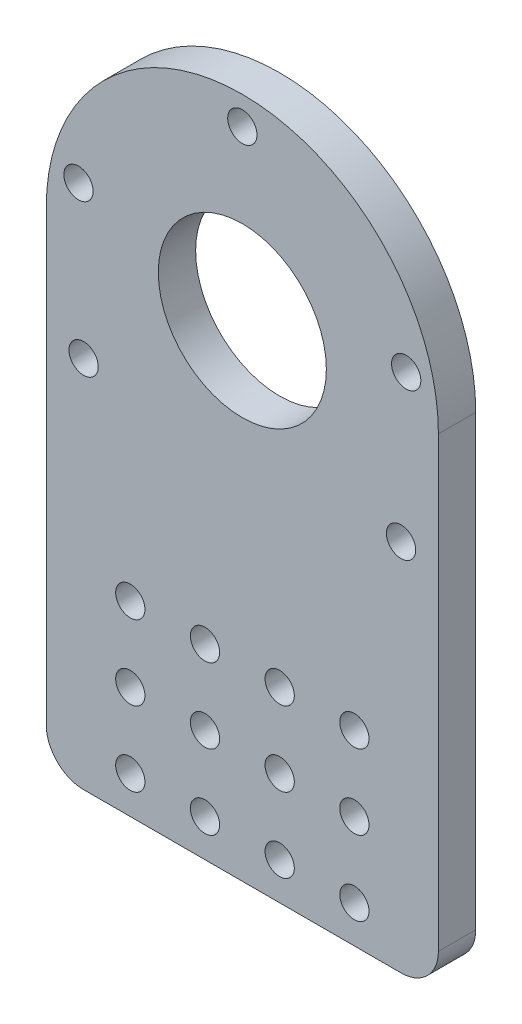
from build123d import *

# Parameters (mm, degrees)
SKETCH1_R           = 14.2875
SKETCH1_R_2         = 2.4892
BOSS_EXTRUDE1_DEPTH = 3.175
FILLET1_R           = 6.35


with BuildPart() as part:
    # Sketch1 → Boss-Extrude1 (new, symmetric)
    with BuildSketch(Plane.XY):
        with BuildLine():
            Line((33.3375, 0), (33.3375, -82.55))
            Line((33.3375, -82.55), (-33.3375, -82.55))
            Line((-33.3375, -82.55), (-33.3375, 0))
            ThreePointArc((-33.3375, 0), (0, 33.3375), (33.3375, 0))
        make_face()
        Circle(SKETCH1_R, mode=Mode.SUBTRACT)
        with Locations((-19.05, -76.2)):
            Circle(SKETCH1_R_2, mode=Mode.SUBTRACT)
        with Locations((-6.35, -76.2)):
            Circle(SKETCH1_R_2, mode=Mode.SUBTRACT)
        with Locations((-6.35, -63.5)):
            Circle(SKETCH1_R_2, mode=Mode.SUBTRACT)
        with Locations((-19.05, -63.5)):
            Circle(SKETCH1_R_2, mode=Mode.SUBTRACT)
        with Locations((6.35, -76.2)):
            Circle(SKETCH1_R_2, mode=Mode.SUBTRACT)
        with Locations((6.35, -63.5)):
            Circle(SKETCH1_R_2, mode=Mode.SUBTRACT)
        with Locations((-19.05, -50.8)):
            Circle(SKETCH1_R_2, mode=Mode.SUBTRACT)
        with Locations((-6.35, -50.8)):
            Circle(SKETCH1_R_2, mode=Mode.SUBTRACT)
        with Locations((6.35, -50.8)):
            Circle(SKETCH1_R_2, mode=Mode.SUBTRACT)
        with Locations((26.9875, -19.05)):
            Circle(SKETCH1_R_2, mode=Mode.SUBTRACT)
        with Locations((19.05, -76.2)):
            Circle(SKETCH1_R_2, mode=Mode.SUBTRACT)
        with Locations((19.05, -63.5)):
            Circle(SKETCH1_R_2, mode=Mode.SUBTRACT)
        with Locations((19.05, -50.8)):
            Circle(SKETCH1_R_2, mode=Mode.SUBTRACT)
        with Locations((0, 28.575)):
            Circle(SKETCH1_R_2, mode=Mode.SUBTRACT)
        with Locations((-27.86051193, 6.35)):
            Circle(SKETCH1_R_2, mode=Mode.SUBTRACT)
        with Locations((27.86051193, 6.35)):
            Circle(SKETCH1_R_2, mode=Mode.SUBTRACT)
        with Locations((-26.9875, -19.05)):
            Circle(SKETCH1_R_2, mode=Mode.SUBTRACT)
    extrude(amount=BOSS_EXTRUDE1_DEPTH, both=True)

    # Fillet1
    fillet1_edges = [part.edges().sort_by_distance(p)[0] for p in [
        (-33.3375, -82.55, 0),
        (33.3375, -82.55, 0),
    ]]
    fillet(fillet1_edges, radius=FILLET1_R)


solid = part.part
